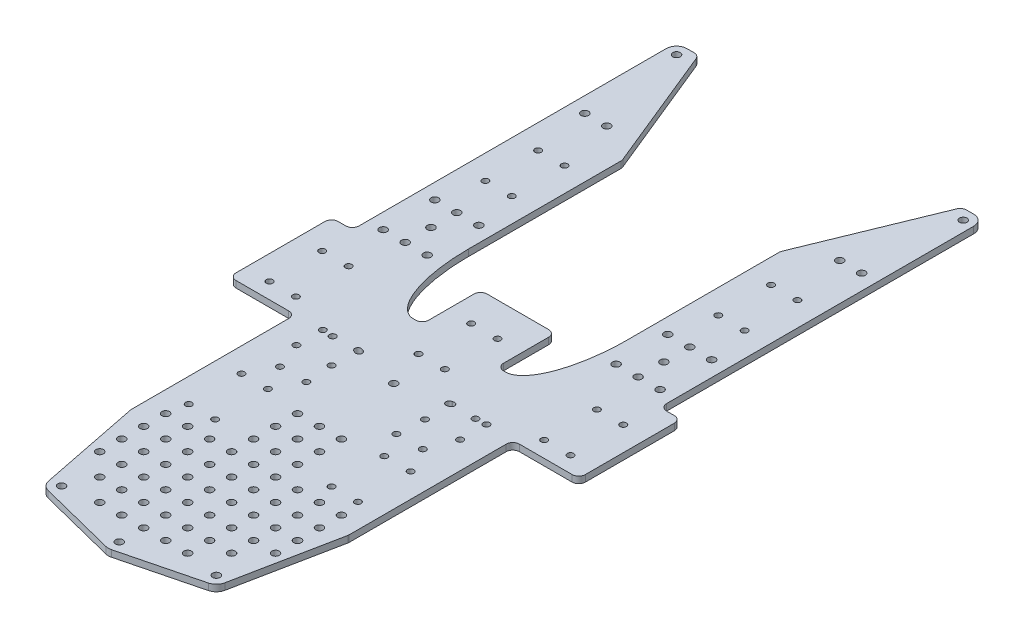
from build123d import *

# Parameters (mm, degrees)
SKETCH4_W              = 210
SKETCH4_H              = 3
BOSS_EXTRUDE1_DEPTH    = 79.5
M2_5_CLEARANCE_HOLE2_D = 2.9
SKETCH14_W             = 9.5
SKETCH14_H             = 88.75
SKETCH14_W_2           = 30
SKETCH14_H_2           = 74.75
CUT_EXTRUDE1_DEPTH     = 136.754373779
FILLET3_SIZE           = 15
FILLET3_SIZE_2         = 40
BOSS_EXTRUDE2_DEPTH    = 3
M3_CLEARANCE_HOLE1_D   = 3.4
FILLET2_R              = 3
M2_5_CLEARANCE_HOLE1_D = 2.9
M3_CLEARANCE_HOLE2_D   = 3.4
FILLET4_R              = 1


with BuildPart() as part:
    # Sketch4 → Boss-Extrude1 (new body)
    with BuildSketch(Plane(origin=(0, 0, 0), x_dir=(0, 0, -1), z_dir=(1, 0, 0))):
        with Locations((-5, -1.5)):
            Rectangle(SKETCH4_W, SKETCH4_H)
    extrude(amount=BOSS_EXTRUDE1_DEPTH)

    # M2.5 Clearance Hole2 (through all)
    with Locations(Plane.XZ.offset(3)):
        with Locations((26.5, 94.75), (38.5, 94.75), (38.5, 70.75), (26.5, 70.75), (59, -84.75), (47, -84.75), (47, -60.75), (59, -60.75), (6, 22.697808823), (6, -1.302191177), (68.5, 4), (56.5, 4), (56.5, 28), (68.5, 28)):
            Hole(M2_5_CLEARANCE_HOLE2_D / 2)

    # Sketch14 → Cut-Extrude1 (cut, through all)
    with BuildSketch(Plane(origin=(0, 0, 0), x_dir=(1, 0, 0), z_dir=(0, 1, 0))):
        with Locations((74.75, 55.625)):
            Rectangle(SKETCH14_W, SKETCH14_H)
        with Locations((64.5, -72.625)):
            Rectangle(SKETCH14_W_2, SKETCH14_H_2)
        Polygon((17, 16.552191177), (17, -10), (36, -10), (36, 100), (0, 100), (0, 16.552191177), align=None)
    extrude(amount=-CUT_EXTRUDE1_DEPTH, mode=Mode.SUBTRACT)

    # Fillet3
    # an asymmetric fillet: 40, 15 mm, written as the material it adds along each edge
    with BuildSketch(Plane(origin=(36, 0, 10), x_dir=(-1, 0, 0), z_dir=(0, -1, 0))) as fillet3_piece_1:
        with BuildLine():
            Bezier((FILLET3_SIZE, 0), (0, 0), (0, FILLET3_SIZE_2), weights=[1, 0.707106781, 1])
            Line((0, FILLET3_SIZE_2), (0, 0))
            Line((0, 0), (FILLET3_SIZE, 0))
        make_face()
    extrude(amount=3)

    # Mirror1: part across plane


with BuildPart() as part_1:
    add(part.part)
    add(part.part.mirror(Plane(origin=(0, 0, 0), x_dir=(0, 0, 1), z_dir=(1, 0, 0))))

    # Sketch18 → Boss-Extrude2 (add)
    with BuildSketch(Plane(origin=(0, 0, 0), x_dir=(1, 0, 0), z_dir=(0, 1, 0))):
        with BuildLine():
            Line((1.227109335, -169.689339409), (36.442706526, -160.773998348))
            ThreePointArc((36.442706526, -160.773998348), (38.839368962, -159.371953218), (40.11850057, -156.907497151))
            Line((40.11850057, -156.907497151), (49.5, -110))
            Line((49.5, -110), (-49.5, -110))
            Line((-49.5, -110), (-40.11850057, -156.907497151))
            ThreePointArc((-40.11850057, -156.907497151), (-38.839368962, -159.371953218), (-36.442706526, -160.773998348))
            Line((-36.442706526, -160.773998348), (-1.227109335, -169.689339409))
            ThreePointArc((-1.227109335, -169.689339409), (0, -169.842257536), (1.227109335, -169.689339409))
        make_face()
        with BuildLine():
            Line((36, 100), (70, 100))
            Line((70, 100), (70, 153.9875))
            ThreePointArc((70, 153.9875), (68.605096045, 157.355096045), (65.2375, 158.75))
            Line((65.2375, 158.75), (60, 158.75))
            Line((60, 158.75), (36, 100))
        make_face()
        with BuildLine():
            Line((-70, 153.9875), (-70, 100))
            Line((-70, 100), (-36, 100))
            Line((-36, 100), (-60, 158.75))
            Line((-60, 158.75), (-65.2375, 158.75))
            ThreePointArc((-65.2375, 158.75), (-68.605096045, 157.355096045), (-70, 153.9875))
        make_face()
    extrude(amount=-BOSS_EXTRUDE2_DEPTH)

    # M3 Clearance Hole1 (through all)
    with Locations(Plane(origin=(0, 0, 0), x_dir=(1, 0, 0), z_dir=(0, 1, 0))):
        with Locations((0, -39.947808823), (0, -164.842257536), (53, 30), (-53, 30), (35.215597191, -155.926916475), (-35.215597191, -155.926916475), (65.2375, 153.9875), (-65.2375, 153.9875)):
            Hole(M3_CLEARANCE_HOLE1_D / 2)

    # Fillet2
    fillet2_edges = [part_1.edges().sort_by_distance(p)[0] for p in [
        (17, -1.5, 10),
        (17, -1.5, -16.552191177),
        (-17, -1.5, -16.552191177),
        (-17, -1.5, 10),
        (-70, -1.5, -11.25),
        (-79.5, -1.5, -11.25),
        (-79.5, -1.5, 35.25),
        (-49.5, -1.5, 35.25),
        (49.5, -1.5, 35.25),
        (79.5, -1.5, 35.25),
        (79.5, -1.5, -11.25),
        (70, -1.5, -11.25),
        (49.5, -1.5, 110),
        (-49.5, -1.5, 110),
        (-36, -1.5, -100),
        (-60, -1.5, -158.75),
        (60, -1.5, -158.75),
        (36, -1.5, -100),
    ]]
    fillet(fillet2_edges, radius=FILLET2_R)

    # M2.5 Clearance Hole1 (through all)
    with Locations(Plane(origin=(0, 0, 0), x_dir=(1, 0, 0), z_dir=(0, 1, 0))):
        with Locations((32.5, -59.25), (20.5, -59.25), (20.5, -35.25), (32.5, -35.25), (-20.5, -35.25), (-32.5, -35.25), (-32.5, -59.25), (-20.5, -59.25), (37.25, -47), (37.25, -35), (21.25, -35), (21.25, -47), (-21.25, -47), (-37.25, -47), (-37.25, -35), (-21.25, -35)):
            Hole(M2_5_CLEARANCE_HOLE1_D / 2)

    # M3 Clearance Hole2 (through all)
    with Locations(Plane(origin=(0, 0, 0), x_dir=(1, 0, 0), z_dir=(0, 1, 0))):
        with Locations((40, -103.75), (30, -103.75), (20, -103.75), (10, -103.75), (0, -103.75), (30, -113.75), (20, -113.75), (10, -113.75), (0, -113.75), (30, -123.75), (20, -123.75), (10, -123.75), (0, -123.75), (30, -133.75), (20, -133.75), (10, -133.75), (0, -133.75), (30, -143.75), (20, -143.75), (10, -143.75), (0, -143.75), (20, -153.75), (10, -153.75), (0, -153.75), (40, -113.75), (40, -123.75), (40, -133.75), (-40, -133.75), (-40, -123.75), (-40, -113.75), (-10, -153.75), (-20, -153.75), (-10, -143.75), (-20, -143.75), (-30, -143.75), (-10, -133.75), (-20, -133.75), (-30, -133.75), (-10, -123.75), (-20, -123.75), (-30, -123.75), (-10, -113.75), (-20, -113.75), (-30, -113.75), (-10, -103.75), (-20, -103.75), (-30, -103.75), (-40, -103.75), (10, -93.75), (0, -93.75), (-10, -93.75), (10, -83.75), (0, -83.75), (-10, -83.75), (10, -73.75), (0, -73.75), (-10, -73.75), (43, 41.75), (63, 41.75), (53, 110), (63, 110), (-63, 110), (-53, 110), (-63, 41.75), (-43, 41.75), (-43, 18.25), (-63, 18.25), (63, 18.25), (43, 18.25), (53, 18.25), (53, 41.75), (-53, 41.75), (-53, 18.25)):
            Hole(M3_CLEARANCE_HOLE2_D / 2)

    # Fillet4
    fillet4_edges = [part_1.edges().sort_by_distance(p)[0] for p in [
        (-21.316163235, -1.5, 36.448489705),
        (-20.433836765, -1.5, 33.801510295),
        (20.433836765, -1.5, 33.801510295),
        (21.316163235, -1.5, 36.448489705),
    ]]
    fillet(fillet4_edges, radius=FILLET4_R)


solid = part_1.part
